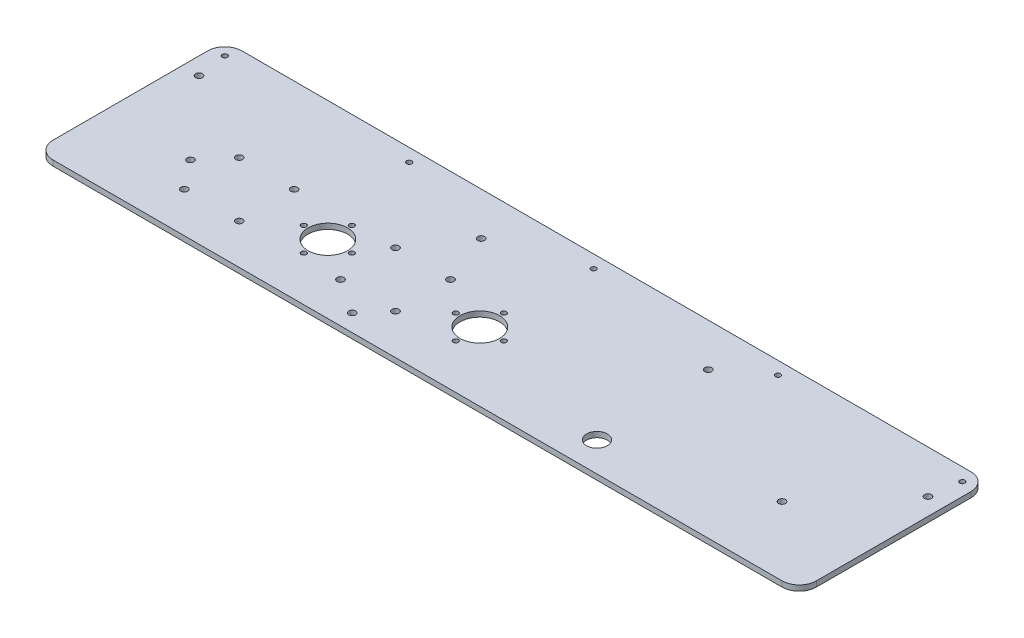
from build123d import *

# Parameters (mm, degrees)
SKETCH1_R           = 2
SKETCH1_R_2         = 1.5
SKETCH1_R_3         = 6
SKETCH1_R_4         = 11.5
BOSS_EXTRUDE1_DEPTH = 3.175
FILLET1_R           = 10
SKETCH2_R           = 2
CUT_EXTRUDE1_DEPTH  = 10


with BuildPart() as part:
    # Sketch1 → Boss-Extrude1 (new body)
    with BuildSketch(Plane(origin=(0, 0, 0), x_dir=(1, 0, 0), z_dir=(0, 1, 0))):
        Polygon((-26.799577535, 0), (417.700422465, 0), (417.700422465, 17.22815868), (417.700422465, 110), (-26.799577535, 110), align=None)
        with Locations((23.200422465, 40)):
            Circle(SKETCH1_R, mode=Mode.SUBTRACT)
        with Locations((89.200422465, 40)):
            Circle(SKETCH1_R_2, mode=Mode.SUBTRACT)
        with Locations((103.200422465, 26)):
            Circle(SKETCH1_R_2, mode=Mode.SUBTRACT)
        with Locations((117.200422465, 40)):
            Circle(SKETCH1_R_2, mode=Mode.SUBTRACT)
        with Locations((177.700422465, 40)):
            Circle(SKETCH1_R_2, mode=Mode.SUBTRACT)
        with Locations((191.700422465, 26)):
            Circle(SKETCH1_R_2, mode=Mode.SUBTRACT)
        with Locations((205.700422465, 40)):
            Circle(SKETCH1_R_2, mode=Mode.SUBTRACT)
        with Locations((367.700422465, 40)):
            Circle(SKETCH1_R, mode=Mode.SUBTRACT)
        with Locations((147.450422465, 10)):
            Circle(SKETCH1_R, mode=Mode.SUBTRACT)
        with Locations((282.700422465, 17.22815868)):
            Circle(SKETCH1_R_3, mode=Mode.SUBTRACT)
        with Locations((-16.799577535, 85)):
            Circle(SKETCH1_R, mode=Mode.SUBTRACT)
        with Locations((147.450422465, 85)):
            Circle(SKETCH1_R, mode=Mode.SUBTRACT)
        with Locations((103.200422465, 54)):
            Circle(SKETCH1_R_2, mode=Mode.SUBTRACT)
        with Locations((103.200422465, 40)):
            Circle(SKETCH1_R_4, mode=Mode.SUBTRACT)
        with Locations((279.700422465, 85)):
            Circle(SKETCH1_R, mode=Mode.SUBTRACT)
        with Locations((191.700422465, 54)):
            Circle(SKETCH1_R_2, mode=Mode.SUBTRACT)
        with Locations((191.700422465, 40)):
            Circle(SKETCH1_R_4, mode=Mode.SUBTRACT)
        with Locations((407.700422465, 85)):
            Circle(SKETCH1_R, mode=Mode.SUBTRACT)
        with Locations((-19.299577535, 102.5)):
            Circle(SKETCH1_R_2, mode=Mode.SUBTRACT)
        with Locations((88.075422465, 102.5)):
            Circle(SKETCH1_R_2, mode=Mode.SUBTRACT)
        with Locations((195.450422465, 102.5)):
            Circle(SKETCH1_R_2, mode=Mode.SUBTRACT)
        with Locations((302.825422465, 102.5)):
            Circle(SKETCH1_R_2, mode=Mode.SUBTRACT)
        with Locations((410.200422465, 102.5)):
            Circle(SKETCH1_R_2, mode=Mode.SUBTRACT)
    extrude(amount=BOSS_EXTRUDE1_DEPTH)

    # Fillet1
    fillet1_edges = [part.edges().sort_by_distance(p)[0] for p in [
        (417.700422465, 1.5875, -110),
        (417.700422465, 1.5875, 0),
        (-26.799577535, 1.5875, 0),
        (-26.799577535, 1.5875, -110),
    ]]
    fillet(fillet1_edges, radius=FILLET1_R)

    # Sketch2 → Cut-Extrude1 (cut)
    with BuildSketch(Plane(origin=(0, 3.175, 0), x_dir=(1, 0, 0), z_dir=(0, 1, 0))):
        with Locations((36.200422465, 55.40559892)):
            Circle(SKETCH2_R)
        with Locations((68.200422465, 55.40559892)):
            Circle(SKETCH2_R)
        with Locations((36.200422465, 23.40559892)):
            Circle(SKETCH2_R)
        with Locations((68.200422465, 23.40559892)):
            Circle(SKETCH2_R)
        with Locations((127.200422465, 55.40559892)):
            Circle(SKETCH2_R)
        with Locations((159.200422465, 55.40559892)):
            Circle(SKETCH2_R)
        with Locations((159.200422465, 23.40559892)):
            Circle(SKETCH2_R)
        with Locations((127.200422465, 23.40559892)):
            Circle(SKETCH2_R)
    extrude(amount=-CUT_EXTRUDE1_DEPTH, mode=Mode.SUBTRACT)


solid = part.part
